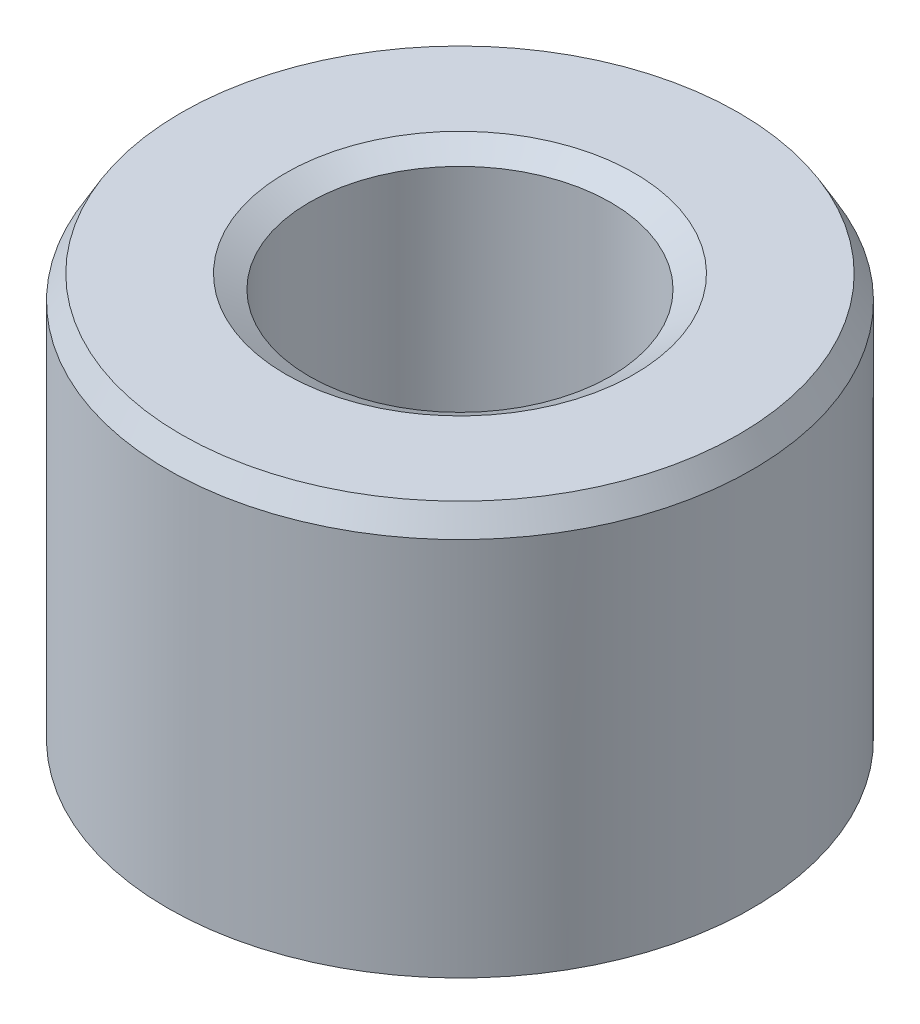
from build123d import *
from OCP.BRepFilletAPI import BRepFilletAPI_MakeChamfer

# Parameters (mm, degrees)
SKETCH1_R           = 10
BOSS_EXTRUDE1_DEPTH = 14.259259792
SKETCH2_R           = 5.153364286
CUT_EXTRUDE1_DEPTH  = 21.082990062
CHAMFER1_SIZE       = 0.808432241
CHAMFER1_SIZE2      = 0.466748572


with BuildPart() as part:
    # Sketch1 → Boss-Extrude1 (new body)
    with BuildSketch(Plane(origin=(0, 0, 0), x_dir=(1, 0, 0), z_dir=(0, 1, 0))):
        Circle(SKETCH1_R)
    extrude(amount=BOSS_EXTRUDE1_DEPTH)

    # Sketch2 → Cut-Extrude1 (cut, through all)
    with BuildSketch(Plane(origin=(0, 0, 0), x_dir=(1, 0, 0), z_dir=(0, 1, 0))):
        Circle(SKETCH2_R)
    extrude(amount=CUT_EXTRUDE1_DEPTH, mode=Mode.SUBTRACT)

    # Chamfer1: one chamfer whose edges measure the first distance from different faces: ONE call of the kernel's chamfer builder (chamfer() names one face for all edges)
    chamfer1_edges_1 = [part.edges().sort_by_distance(p)[0] for p in [
        (-5.153364286, 14.259259792, 0),
    ]]
    chamfer1_side_1 = [part.faces().sort_by_distance(p)[0] for p in [
        (-9.717157288, 14.259259792, 0),
    ]]
    chamfer1_edges_2 = [part.edges().sort_by_distance(p)[0] for p in [
        (-5.153364286, 0, 0),
    ]]
    chamfer1_side_2 = [part.faces().sort_by_distance(p)[0] for p in [
        (-5.153364286, 7.129629896, 0),
    ]]
    chamfer1_edges_3 = [part.edges().sort_by_distance(p)[0] for p in [
        (-10, 0, 0),
    ]]
    chamfer1_side_3 = [part.faces().sort_by_distance(p)[0] for p in [
        (-9.717157288, 0, 0),
    ]]
    chamfer1_edges_4 = [part.edges().sort_by_distance(p)[0] for p in [
        (-10, 14.259259792, 0),
    ]]
    chamfer1_side_4 = [part.faces().sort_by_distance(p)[0] for p in [
        (-10, 7.129629896, 0),
    ]]
    chamfer1 = BRepFilletAPI_MakeChamfer(part.part.solid().wrapped)
    for e in chamfer1_edges_1:
        chamfer1.Add(CHAMFER1_SIZE, CHAMFER1_SIZE2, e.wrapped, chamfer1_side_1[0].wrapped)  # the first distance lies on this face
    for e in chamfer1_edges_2:
        chamfer1.Add(CHAMFER1_SIZE, CHAMFER1_SIZE2, e.wrapped, chamfer1_side_2[0].wrapped)  # the first distance lies on this face
    for e in chamfer1_edges_3:
        chamfer1.Add(CHAMFER1_SIZE, CHAMFER1_SIZE2, e.wrapped, chamfer1_side_3[0].wrapped)  # the first distance lies on this face
    for e in chamfer1_edges_4:
        chamfer1.Add(CHAMFER1_SIZE, CHAMFER1_SIZE2, e.wrapped, chamfer1_side_4[0].wrapped)  # the first distance lies on this face
    add(Compound.cast(chamfer1.Shape()), mode=Mode.REPLACE)


solid = part.part
